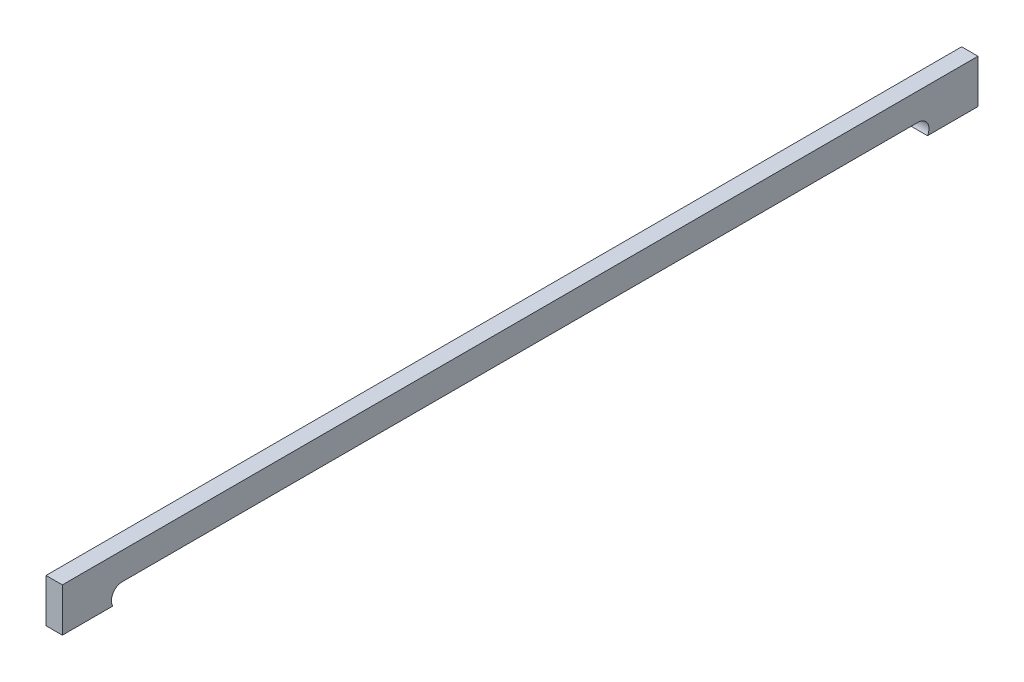
from build123d import *

# Parameters (mm, degrees)
BOSS_EXTRUDE1_DEPTH = 10
CUT_EXTRUDE1_DEPTH  = 10
SKETCH4_W           = 170
SKETCH4_H           = 2
CUT_EXTRUDE2_DEPTH  = 10
CUT_EXTRUDE4_START  = -10
CUT_EXTRUDE4_DEPTH  = 10
SKETCH9_W           = 4.225609452
SKETCH9_H           = 1
SKETCH9_W_2         = 4.088650431
CUT_EXTRUDE5_DEPTH  = 10
SKETCH10_W          = 168
SKETCH10_H          = 2
CUT_EXTRUDE6_DEPTH  = 10
SKETCH11_W          = 168
SKETCH11_H          = 2
BOSS_EXTRUDE6_DEPTH = 3


with BuildPart() as part:
    # Sketch1 → Boss-Extrude1 (new body)
    with BuildSketch(Plane(origin=(0, 0, 0), x_dir=(1, 0, 0), z_dir=(0, 1, 0))):
        with BuildLine():
            Line((11.152393634, 3.852474108), (11.152393634, 173.352474108))
            ThreePointArc((11.152393634, 173.352474108), (11.225616938, 173.529250803), (11.402393634, 173.602474108))
            Line((11.402393634, 173.602474108), (15.902393634, 173.602474108))
            ThreePointArc((15.902393634, 173.602474108), (16.079170329, 173.529250803), (16.152393634, 173.352474108))
            Line((16.152393634, 173.352474108), (16.152393634, 3.852474108))
            ThreePointArc((16.152393634, 3.852474108), (16.079170329, 3.675697413), (15.902393634, 3.602474108))
            Line((15.902393634, 3.602474108), (11.402393634, 3.602474108))
            ThreePointArc((11.402393634, 3.602474108), (11.225616938, 3.675697413), (11.152393634, 3.852474108))
        make_face()
    extrude(amount=BOSS_EXTRUDE1_DEPTH)

    # Sketch2 → Cut-Extrude1 (cut)
    with BuildSketch(Plane(origin=(16.152393634, 0, 0), x_dir=(0, 0, -1), z_dir=(1, 0, 0))):
        with BuildLine():
            Line((15.602474108, 7), (161.602474108, 7))
            ThreePointArc((161.602474108, 7), (163.602474108, 5), (161.602474108, 3))
            Line((161.602474108, 3), (15.602474108, 3))
            ThreePointArc((15.602474108, 3), (13.602474108, 5), (15.602474108, 7))
        make_face()
    extrude(amount=-CUT_EXTRUDE1_DEPTH, mode=Mode.SUBTRACT)

    # Sketch4 → Cut-Extrude2 (cut)
    with BuildSketch(Plane(origin=(16.152393634, 0, 0), x_dir=(0, 0, -1), z_dir=(1, 0, 0))):
        with Locations((88.602474108, 1)):
            Rectangle(SKETCH4_W, SKETCH4_H)
    extrude(amount=-CUT_EXTRUDE2_DEPTH, mode=Mode.SUBTRACT)

    # Sketch8 → Cut-Extrude4 (cut)
    with BuildSketch(Plane(origin=(0, 10, 0), x_dir=(1, 0, 0), z_dir=(0, 1, 0)).offset(CUT_EXTRUDE4_START)):
        with BuildLine():
            ThreePointArc((15.902393634, 3.602474108), (16.079170329, 3.675697413), (16.152393634, 3.852474108))
            Line((16.152393634, 3.852474108), (16.152393634, 173.352474108))
            ThreePointArc((16.152393634, 173.352474108), (16.079170329, 173.529250803), (15.902393634, 173.602474108))
            Line((15.902393634, 173.602474108), (15.152393634, 173.602474108))
            Line((15.152393634, 173.602474108), (15.152393634, 3.602474108))
            Line((15.152393634, 3.602474108), (15.902393634, 3.602474108))
        make_face()
        with BuildLine():
            Line((11.402393634, 3.602474108), (12.152393634, 3.602474108))
            Line((12.152393634, 3.602474108), (12.152393634, 173.602474108))
            Line((12.152393634, 173.602474108), (11.402393634, 173.602474108))
            ThreePointArc((11.402393634, 173.602474108), (11.225616938, 173.529250803), (11.152393634, 173.352474108))
            Line((11.152393634, 173.352474108), (11.152393634, 3.852474108))
            ThreePointArc((11.152393634, 3.852474108), (11.225616938, 3.675697413), (11.402393634, 3.602474108))
        make_face()
    extrude(amount=CUT_EXTRUDE4_DEPTH, mode=Mode.SUBTRACT)

    # Sketch9 → Cut-Extrude5 (cut)
    with BuildSketch(Plane(origin=(0, 10, 0), x_dir=(1, 0, 0), z_dir=(0, 1, 0))):
        with Locations((13.763215324, 173.102474108)):
            Rectangle(SKETCH9_W, SKETCH9_H)
        with Locations((13.694735813, 4.102474108)):
            Rectangle(SKETCH9_W_2, SKETCH9_H)
    extrude(amount=-CUT_EXTRUDE5_DEPTH, mode=Mode.SUBTRACT)

    # Sketch10 → Cut-Extrude6 (cut)
    with BuildSketch(Plane(origin=(15.152393634, 0, 0), x_dir=(0, 0, -1), z_dir=(1, 0, 0))):
        with Locations((88.602474108, 3)):
            Rectangle(SKETCH10_W, SKETCH10_H)
    extrude(amount=-CUT_EXTRUDE6_DEPTH, mode=Mode.SUBTRACT)

    # Sketch11 → Boss-Extrude6 (add)
    with BuildSketch(Plane(origin=(15.152393634, 0, 0), x_dir=(0, 0, -1), z_dir=(1, 0, 0))):
        with Locations((88.602474108, 11)):
            Rectangle(SKETCH11_W, SKETCH11_H)
    extrude(amount=-BOSS_EXTRUDE6_DEPTH)


solid = part.part
